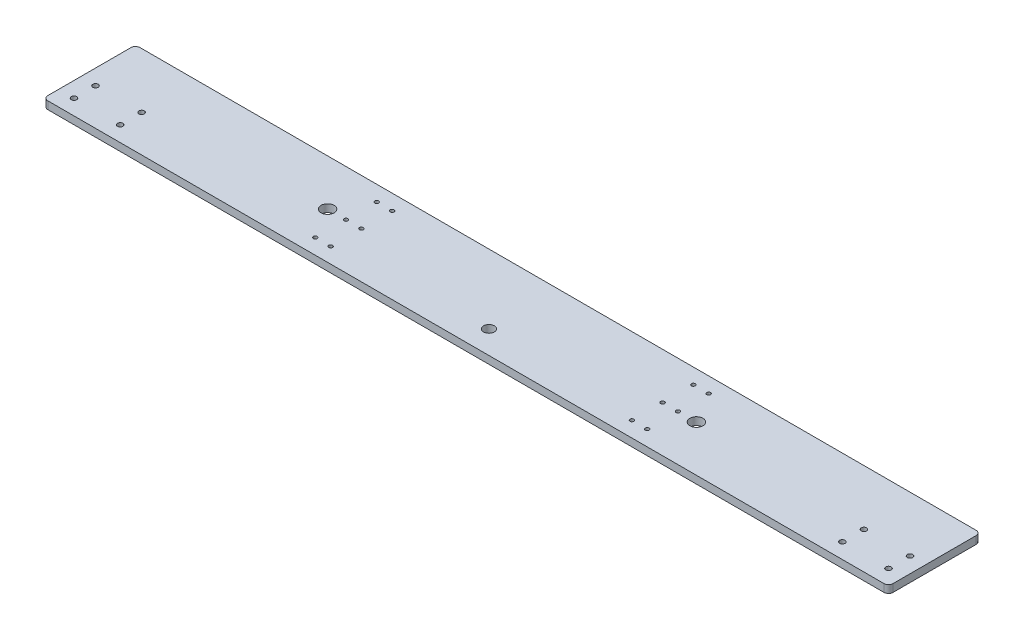
from build123d import *

# Parameters (mm, degrees)
SKETCH_1_W                  = 550
SKETCH_1_H                  = 60
EXTRUDE_1_DEPTH             = 5
SKETCH_2_R                  = 3.5
CUT_EXTRUDE_2_DEPTH         = 277.676706645
SKETCH_4_R                  = 1
CUT_EXTRUDE_4_DEPTH         = 277.676706645
PATTERN_LINEAR_2_COUNT      = 3
PATTERN_LINEAR_2_PITCH      = 20
PATTERN_LINEAR_2_COUNT_DIR2 = 2
PATTERN_LINEAR_2_PITCH_DIR2 = 10
MIRROR_1_COPY_1_SKETCH_R    = 1
MIRROR_1_COPY_1_DEPTH       = 277.676706645
MIRROR_1_COPY_2_SKETCH_R    = 1
MIRROR_1_COPY_2_DEPTH       = 277.676706645
MIRROR_1_COPY_3_SKETCH_R    = 1
MIRROR_1_COPY_3_DEPTH       = 277.676706645
MIRROR_1_COPY_4_SKETCH_R    = 1
MIRROR_1_COPY_4_DEPTH       = 277.676706645
MIRROR_1_COPY_5_SKETCH_R    = 1
MIRROR_1_COPY_5_DEPTH       = 277.676706645
MIRROR_1_COPY_6_SKETCH_R    = 1
MIRROR_1_COPY_6_DEPTH       = 277.676706645
SKETCH_6_R                  = 1.75
CUT_EXTRUDE_5_DEPTH         = 277.676706645
PATTERN_LINEAR_3_COUNT      = 2
PATTERN_LINEAR_3_PITCH      = 14
PATTERN_LINEAR_3_COUNT_DIR2 = 2
PATTERN_LINEAR_3_PITCH_DIR2 = 30
MIRROR_2_COPY_1_SKETCH_R    = 1.75
MIRROR_2_COPY_1_DEPTH       = 277.676706645
MIRROR_2_COPY_2_SKETCH_R    = 1.75
MIRROR_2_COPY_2_DEPTH       = 277.676706645
MIRROR_2_COPY_3_SKETCH_R    = 1.75
MIRROR_2_COPY_3_DEPTH       = 277.676706645
MIRROR_2_COPY_4_SKETCH_R    = 1.75
MIRROR_2_COPY_4_DEPTH       = 277.676706645
SKETCH_7_R                  = 4.25
CUT_EXTRUDE_6_DEPTH         = 10
FILLET_3_R                  = 3
FILLET_4_R                  = 3
FILLET_5_R                  = 3
FILLET_6_R                  = 3
HOLE_WIZARD_M3_2_D          = 2.5


with BuildPart() as part:
    # 草图1 → 凸台-拉伸1 (new body)
    with BuildSketch(Plane(origin=(0, 0, 0), x_dir=(1, 0, 0), z_dir=(0, 1, 0))):
        Rectangle(SKETCH_1_W, SKETCH_1_H)
    extrude(amount=-EXTRUDE_1_DEPTH)

    # 草图2 → 切除-拉伸2 (cut, through all)
    with BuildSketch(Plane(origin=(0, 0, 0), x_dir=(1, 0, 0), z_dir=(0, 1, 0))):
        with Locations((0, -15)):
            Circle(SKETCH_2_R)
    extrude(amount=-CUT_EXTRUDE_2_DEPTH, mode=Mode.SUBTRACT)

    # 草图4 → 切除-拉伸4 (cut, through all)
    with BuildSketch(Plane(origin=(0, 0, 0), x_dir=(1, 0, 0), z_dir=(0, 1, 0))):
        with Locations((-98, -20)):
            Circle(SKETCH_4_R)
    cut_extrude_4 = extrude(amount=-CUT_EXTRUDE_4_DEPTH, mode=Mode.SUBTRACT)

    # 阵列(线性)2: Cut-Extrude 4 3 × 2
    with Locations(*[(-j * PATTERN_LINEAR_2_PITCH_DIR2, 0, -i * PATTERN_LINEAR_2_PITCH) for i in range(PATTERN_LINEAR_2_COUNT) for j in range(PATTERN_LINEAR_2_COUNT_DIR2) if (i, j) != (0, 0)]):
        add(cut_extrude_4, mode=Mode.SUBTRACT)

    # 镜向1 copy 1 sketch → 镜向1 copy 1 (cut, through all)
    with BuildSketch(Plane(origin=(10, 0, 0), x_dir=(-1, 0, 0), z_dir=(0, 1, 0))):
        with Locations((-98, 20)):
            Circle(MIRROR_1_COPY_1_SKETCH_R)
    extrude(amount=-MIRROR_1_COPY_1_DEPTH, mode=Mode.SUBTRACT)

    # 镜向1 copy 2 sketch → 镜向1 copy 2 (cut, through all)
    with BuildSketch(Plane(origin=(0, 0, -20), x_dir=(-1, 0, 0), z_dir=(0, 1, 0))):
        with Locations((-98, 20)):
            Circle(MIRROR_1_COPY_2_SKETCH_R)
    extrude(amount=-MIRROR_1_COPY_2_DEPTH, mode=Mode.SUBTRACT)

    # 镜向1 copy 3 sketch → 镜向1 copy 3 (cut, through all)
    with BuildSketch(Plane(origin=(10, 0, -20), x_dir=(-1, 0, 0), z_dir=(0, 1, 0))):
        with Locations((-98, 20)):
            Circle(MIRROR_1_COPY_3_SKETCH_R)
    extrude(amount=-MIRROR_1_COPY_3_DEPTH, mode=Mode.SUBTRACT)

    # 镜向1 copy 4 sketch → 镜向1 copy 4 (cut, through all)
    with BuildSketch(Plane(origin=(0, 0, -40), x_dir=(-1, 0, 0), z_dir=(0, 1, 0))):
        with Locations((-98, 20)):
            Circle(MIRROR_1_COPY_4_SKETCH_R)
    extrude(amount=-MIRROR_1_COPY_4_DEPTH, mode=Mode.SUBTRACT)

    # 镜向1 copy 5 sketch → 镜向1 copy 5 (cut, through all)
    with BuildSketch(Plane(origin=(10, 0, -40), x_dir=(-1, 0, 0), z_dir=(0, 1, 0))):
        with Locations((-98, 20)):
            Circle(MIRROR_1_COPY_5_SKETCH_R)
    extrude(amount=-MIRROR_1_COPY_5_DEPTH, mode=Mode.SUBTRACT)

    # 镜向1 copy 6 sketch → 镜向1 copy 6 (cut, through all)
    with BuildSketch(Plane(origin=(0, 0, 0), x_dir=(-1, 0, 0), z_dir=(0, 1, 0))):
        with Locations((-98, 20)):
            Circle(MIRROR_1_COPY_6_SKETCH_R)
    extrude(amount=-MIRROR_1_COPY_6_DEPTH, mode=Mode.SUBTRACT)

    # 草图6 → 切除-拉伸5 (cut, through all)
    with BuildSketch(Plane(origin=(0, 0, 0), x_dir=(1, 0, 0), z_dir=(0, 1, 0))):
        with Locations((-265, -20)):
            Circle(SKETCH_6_R)
    cut_extrude_5 = extrude(amount=-CUT_EXTRUDE_5_DEPTH, mode=Mode.SUBTRACT)

    # 阵列(线性)3: Cut-Extrude 5 2 × 2
    with Locations(*[(j * PATTERN_LINEAR_3_PITCH_DIR2, 0, -i * PATTERN_LINEAR_3_PITCH) for i in range(PATTERN_LINEAR_3_COUNT) for j in range(PATTERN_LINEAR_3_COUNT_DIR2) if (i, j) != (0, 0)]):
        add(cut_extrude_5, mode=Mode.SUBTRACT)

    # 镜向2 copy 1 sketch → 镜向2 copy 1 (cut, through all)
    with BuildSketch(Plane(origin=(-30, 0, 0), x_dir=(-1, 0, 0), z_dir=(0, 1, 0))):
        with Locations((-265, 20)):
            Circle(MIRROR_2_COPY_1_SKETCH_R)
    extrude(amount=-MIRROR_2_COPY_1_DEPTH, mode=Mode.SUBTRACT)

    # 镜向2 copy 2 sketch → 镜向2 copy 2 (cut, through all)
    with BuildSketch(Plane(origin=(0, 0, -14), x_dir=(-1, 0, 0), z_dir=(0, 1, 0))):
        with Locations((-265, 20)):
            Circle(MIRROR_2_COPY_2_SKETCH_R)
    extrude(amount=-MIRROR_2_COPY_2_DEPTH, mode=Mode.SUBTRACT)

    # 镜向2 copy 3 sketch → 镜向2 copy 3 (cut, through all)
    with BuildSketch(Plane(origin=(-30, 0, -14), x_dir=(-1, 0, 0), z_dir=(0, 1, 0))):
        with Locations((-265, 20)):
            Circle(MIRROR_2_COPY_3_SKETCH_R)
    extrude(amount=-MIRROR_2_COPY_3_DEPTH, mode=Mode.SUBTRACT)

    # 镜向2 copy 4 sketch → 镜向2 copy 4 (cut, through all)
    with BuildSketch(Plane(origin=(0, 0, 0), x_dir=(-1, 0, 0), z_dir=(0, 1, 0))):
        with Locations((-265, 20)):
            Circle(MIRROR_2_COPY_4_SKETCH_R)
    extrude(amount=-MIRROR_2_COPY_4_DEPTH, mode=Mode.SUBTRACT)

    # 草图7 → 切除-拉伸6 (cut)
    with BuildSketch(Plane(origin=(0, 0, 0), x_dir=(1, 0, 0), z_dir=(0, 1, 0))):
        with Locations((-120, 0)):
            Circle(SKETCH_7_R)
    cut_extrude_6 = extrude(amount=-CUT_EXTRUDE_6_DEPTH, mode=Mode.SUBTRACT)

    # 镜向3: 切除-拉伸6 across plane
    add(cut_extrude_6.mirror(Plane(origin=(0, 0, 0), x_dir=(0, 0, 1), z_dir=(1, 0, 0))), mode=Mode.SUBTRACT)

    # 圆角3
    fillet_3_edges = [part.edges().sort_by_distance(p)[0] for p in [
        (-275, -2.5, 30),
    ]]
    fillet(fillet_3_edges, radius=FILLET_3_R)

    # 圆角4
    fillet_4_edges = [part.edges().sort_by_distance(p)[0] for p in [
        (-275, -2.5, -30),
    ]]
    fillet(fillet_4_edges, radius=FILLET_4_R)

    # 圆角5
    fillet_5_edges = [part.edges().sort_by_distance(p)[0] for p in [
        (275, -2.5, -30),
    ]]
    fillet(fillet_5_edges, radius=FILLET_5_R)

    # 圆角6
    fillet_6_edges = [part.edges().sort_by_distance(p)[0] for p in [
        (275, -2.5, 30),
    ]]
    fillet(fillet_6_edges, radius=FILLET_6_R)

    # M3 螺纹孔2 (through all)
    with Locations(Plane(origin=(0, 0, 0), x_dir=(1, 0, 0), z_dir=(0, 1, 0))):
        with Locations((-98, -20), (-98, 0), (-98, 20), (-108, 20), (-108, 0), (-108, -20), (98, -20), (108, -20), (98, 0), (108, 0), (108, 20), (98, 20)):
            Hole(HOLE_WIZARD_M3_2_D / 2)


solid = part.part
